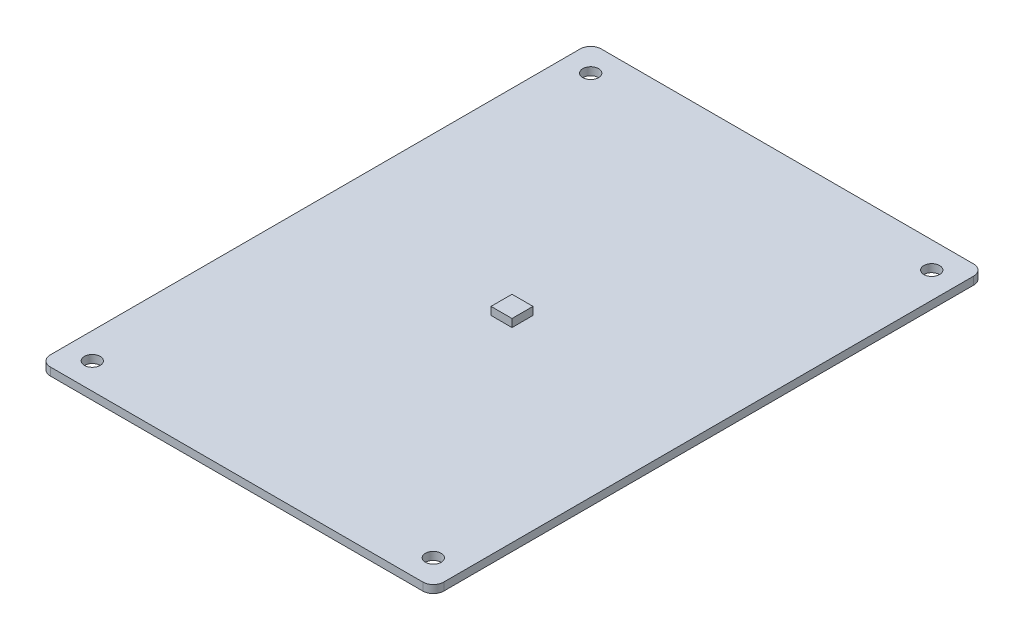
from build123d import *

# Parameters (mm, degrees)
ESQUISSE1_R        = 1.5
BOSS_EXTRU_1_DEPTH = 1.5
ESQUISSE2_W        = 4
ESQUISSE2_H        = 4
BOSS_EXTRU_2_DEPTH = 1.5


with BuildPart() as part:
    # Esquisse1 → Boss.-Extru.1 (new body)
    with BuildSketch(Plane(origin=(0, 0, 0), x_dir=(1, 0, 0), z_dir=(0, 1, 0))):
        with BuildLine():
            Line((-29.485849057, 82.95990566), (41.514150943, 82.95990566))
            ThreePointArc((41.514150943, 82.95990566), (42.928364506, 82.374119223), (43.514150943, 80.95990566))
            Line((43.514150943, 80.95990566), (43.514150943, -20.04009434))
            ThreePointArc((43.514150943, -20.04009434), (42.928364506, -21.454307902), (41.514150943, -22.04009434))
            Line((41.514150943, -22.04009434), (-29.485849057, -22.04009434))
            ThreePointArc((-29.485849057, -22.04009434), (-30.900062619, -21.454307902), (-31.485849057, -20.04009434))
            Line((-31.485849057, -20.04009434), (-31.485849057, 80.95990566))
            ThreePointArc((-31.485849057, 80.95990566), (-30.900062619, 82.374119223), (-29.485849057, 82.95990566))
        make_face()
        with Locations((38.514150943, 77.95990566)):
            Circle(ESQUISSE1_R, mode=Mode.SUBTRACT)
        with Locations((38.514150943, -17.04009434)):
            Circle(ESQUISSE1_R, mode=Mode.SUBTRACT)
        with Locations((-26.485849057, -17.04009434)):
            Circle(ESQUISSE1_R, mode=Mode.SUBTRACT)
        with Locations((-26.485849057, 77.95990566)):
            Circle(ESQUISSE1_R, mode=Mode.SUBTRACT)
    extrude(amount=BOSS_EXTRU_1_DEPTH)

    # Esquisse2 → Boss.-Extru.2 (add)
    with BuildSketch(Plane(origin=(0, 1.5, 0), x_dir=(1, 0, 0), z_dir=(0, 1, 0))):
        with Locations((6.014150943, 30.45990566)):
            Rectangle(ESQUISSE2_W, ESQUISSE2_H)
    extrude(amount=BOSS_EXTRU_2_DEPTH)


solid = part.part
